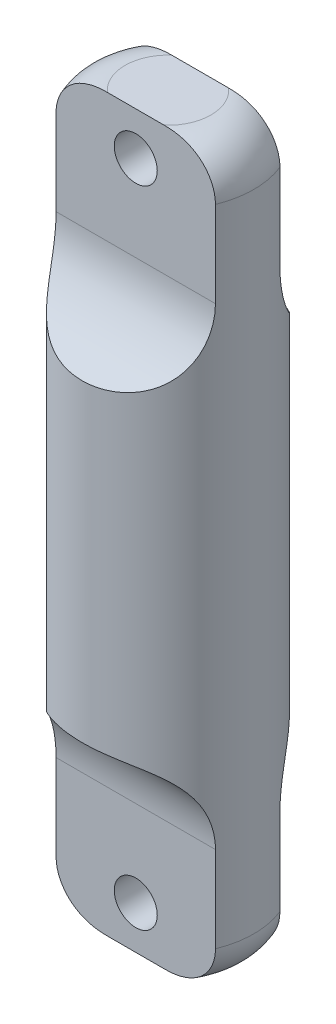
from build123d import *

# Parameters (mm, degrees)
SKETCH1_R           = 12.7
BOSS_EXTRUDE1_DEPTH = 107.95
SKETCH2_W           = 7.9375
SKETCH2_H           = 31.75
CUT_EXTRUDE1_DEPTH  = 112.622813528
FILLET1_R           = 12.7
MIRROR1_START       = -11.773215198
MIRROR1_DEPTH       = 23.546430296
HOLE1_D             = 6.35
FILLET6_R           = 6.35


# Read off the part's stored shape, not the designer's step: Mirror1
with BuildPart() as part:
    # Sketch1 → Boss-Extrude1 (new body)
    with BuildSketch(Plane(origin=(0, 0, 0), x_dir=(1, 0, 0), z_dir=(0, 1, 0))):
        with Locations(Location((0, 0, 0), (0, 0, 270))):
            Circle(SKETCH1_R)
    extrude(amount=BOSS_EXTRUDE1_DEPTH)

    # Sketch2 → Cut-Extrude1 (cut, through all)
    with BuildSketch(Plane(origin=(12.7, 0, 0), x_dir=(0, 0, -1), z_dir=(1, 0, 0))):
        with Locations((8.73125, 92.075)):
            Rectangle(SKETCH2_W, SKETCH2_H)
        with Locations((-8.73125, 92.075)):
            Rectangle(SKETCH2_W, SKETCH2_H)
    extrude(amount=-CUT_EXTRUDE1_DEPTH, mode=Mode.SUBTRACT)

    # Fillet1
    # the kernel refuses this fillet: 12.7 mm, written as the material it adds along each edge
    with BuildSketch(Plane(origin=(43.523215098, 76.2, 4.7625), x_dir=(0, 1, 0), z_dir=(-1, 0, 0))) as fillet1_piece_1_section:
        with BuildLine():
            CenterArc((FILLET1_R, -FILLET1_R), FILLET1_R, 90, 90)
            Line((0, -FILLET1_R), (0, 0))
            Line((0, 0), (FILLET1_R, 0))
        make_face()
    fillet1_piece_1 = extrude(amount=87.046430197, mode=Mode.PRIVATE)
    fillet1_piece_1 = fillet1_piece_1 & Plane(origin=(0, 79.544884305, 0), x_dir=(0, 0, 1), z_dir=(0, -1, 0)) * Cylinder(12.7, 225, mode=Mode.PRIVATE)
    add(fillet1_piece_1)
    with BuildSketch(Plane(origin=(43.523215098, 76.2, -4.7625), x_dir=(0, 0, -1), z_dir=(-1, 0, 0))) as fillet1_piece_2_section:
        with BuildLine():
            CenterArc((FILLET1_R, -FILLET1_R), FILLET1_R, 90, 90)
            Line((0, -FILLET1_R), (0, 0))
            Line((0, 0), (FILLET1_R, 0))
        make_face()
    fillet1_piece_2 = extrude(amount=87.046430197, mode=Mode.PRIVATE)
    fillet1_piece_2 = fillet1_piece_2 & Plane(origin=(0, 79.544821944, 0), x_dir=(0, 0, 1), z_dir=(0, -1, 0)) * Cylinder(12.7, 225, mode=Mode.PRIVATE)
    add(fillet1_piece_2)

    # Mirror1 outline → Mirror1 (cut)
    with BuildSketch(Plane.YZ.offset(MIRROR1_START)):
        with BuildLine():
            Line((19.05, -4.7625), (0, -4.7625))
            Line((0, -4.7625), (0, -14))
            Line((0, -14), (31.349026101, -14))
            Line((31.349026101, -14), (30.823419426, -12.700505142))
            ThreePointArc((30.823419426, -12.700505142), (26.149741731, -6.932368598), (19.05, -4.7625))
        make_face()
        with BuildLine():
            Line((0, 14), (0, 4.7625))
            Line((0, 4.7625), (19.05, 4.7625))
            ThreePointArc((19.05, 4.7625), (26.149741731, 6.932368598), (30.823419426, 12.700505142))
            Line((30.823419426, 12.700505142), (31.349026101, 14))
            Line((31.349026101, 14), (0, 14))
        make_face()
    extrude(amount=MIRROR1_DEPTH, mode=Mode.SUBTRACT)

    # Hole1 (through all)
    with Locations(Plane.XY.offset(4.7625)):
        with Locations((0, 101.6), (0, 6.35)):
            Hole(HOLE1_D / 2)

    # Fillet6
    # the kernel refuses this fillet: 6.35 mm, written as the material it takes off along each edge
    with BuildSketch(Plane(origin=(0, 107.95, 0), x_dir=(-0.06367759150342109, 0, 0.9979705227812711), z_dir=(-0.9979705227812711, 0, -0.06367759150342109))) as fillet6_piece_1:
        with BuildLine():
            CenterArc((12.7 - FILLET6_R, -FILLET6_R), FILLET6_R, 0, 90)
            Line((12.7 - FILLET6_R, 0), (12.7, 0))
            Line((12.7, 0), (12.7, -FILLET6_R))
        make_face()
    revolve(axis=Axis((0, 107.95, 0), (0, 1, 0)), revolution_arc=187.301854803, mode=Mode.SUBTRACT)
    with BuildSketch(Plane(origin=(0, 0, 0), x_dir=(0.06367758856259068, 0, -0.9979705229689169), z_dir=(0.9979705229689169, 0, 0.06367758856259068))) as fillet6_piece_2:
        with BuildLine():
            CenterArc((12.7 - FILLET6_R, FILLET6_R), FILLET6_R, 270, 90)
            Line((12.7 - FILLET6_R, 0), (12.7, 0))
            Line((12.7, 0), (12.7, FILLET6_R))
        make_face()
    revolve(axis=Axis((0, 0, 0), (0, 1, 0)), revolution_arc=187.301854466, mode=Mode.SUBTRACT)
    with BuildSketch(Plane(origin=(0, 107.95, 0), x_dir=(0.06367759150341921, 0, -0.9979705227812712), z_dir=(0.9979705227812712, 0, 0.06367759150341921))) as fillet6_piece_3:
        with BuildLine():
            CenterArc((12.7 - FILLET6_R, -FILLET6_R), FILLET6_R, 0, 90)
            Line((12.7 - FILLET6_R, 0), (12.7, 0))
            Line((12.7, 0), (12.7, -FILLET6_R))
        make_face()
    revolve(axis=Axis((0, 107.95, 0), (0, 1, 0)), revolution_arc=187.301854803, mode=Mode.SUBTRACT)
    with BuildSketch(Plane(origin=(0, 0, 0), x_dir=(-0.06367759151119771, 0, 0.9979705227807748), z_dir=(-0.9979705227807748, 0, -0.06367759151119771))) as fillet6_piece_4:
        with BuildLine():
            CenterArc((12.7 - FILLET6_R, FILLET6_R), FILLET6_R, 270, 90)
            Line((12.7 - FILLET6_R, 0), (12.7, 0))
            Line((12.7, 0), (12.7, FILLET6_R))
        make_face()
    revolve(axis=Axis((0, 0, 0), (0, 1, 0)), revolution_arc=187.301854804, mode=Mode.SUBTRACT)


solid = part.part
